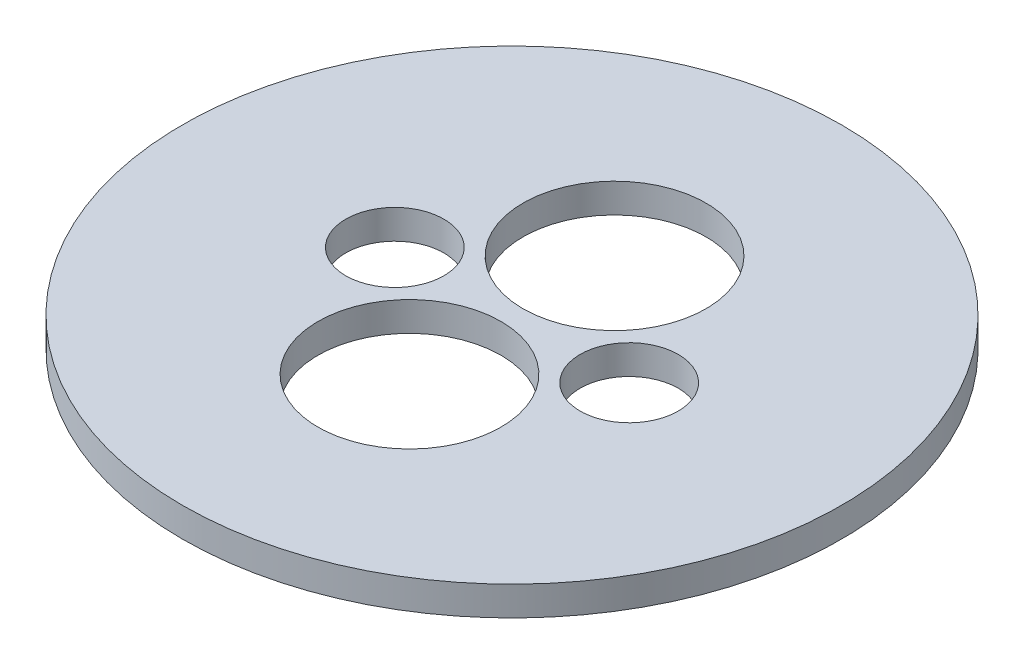
from build123d import *

# Parameters (mm, degrees)
SKETCH1_R           = 1125
SKETCH1_R_2         = 312.5
SKETCH1_R_3         = 167.5
BOSS_EXTRUDE1_DEPTH = 100


with BuildPart() as part:
    # Sketch1 → Boss-Extrude1 (new body)
    with BuildSketch(Plane(origin=(0, 0, 0), x_dir=(1, 0, 0), z_dir=(0, 1, 0))):
        Circle(SKETCH1_R)
        with Locations((0, 350)):
            Circle(SKETCH1_R_2, mode=Mode.SUBTRACT)
        with Locations((-400, 0)):
            Circle(SKETCH1_R_3, mode=Mode.SUBTRACT)
        with Locations((0, -350)):
            Circle(SKETCH1_R_2, mode=Mode.SUBTRACT)
        with Locations((400, 0)):
            Circle(SKETCH1_R_3, mode=Mode.SUBTRACT)
    extrude(amount=BOSS_EXTRUDE1_DEPTH)


solid = part.part
